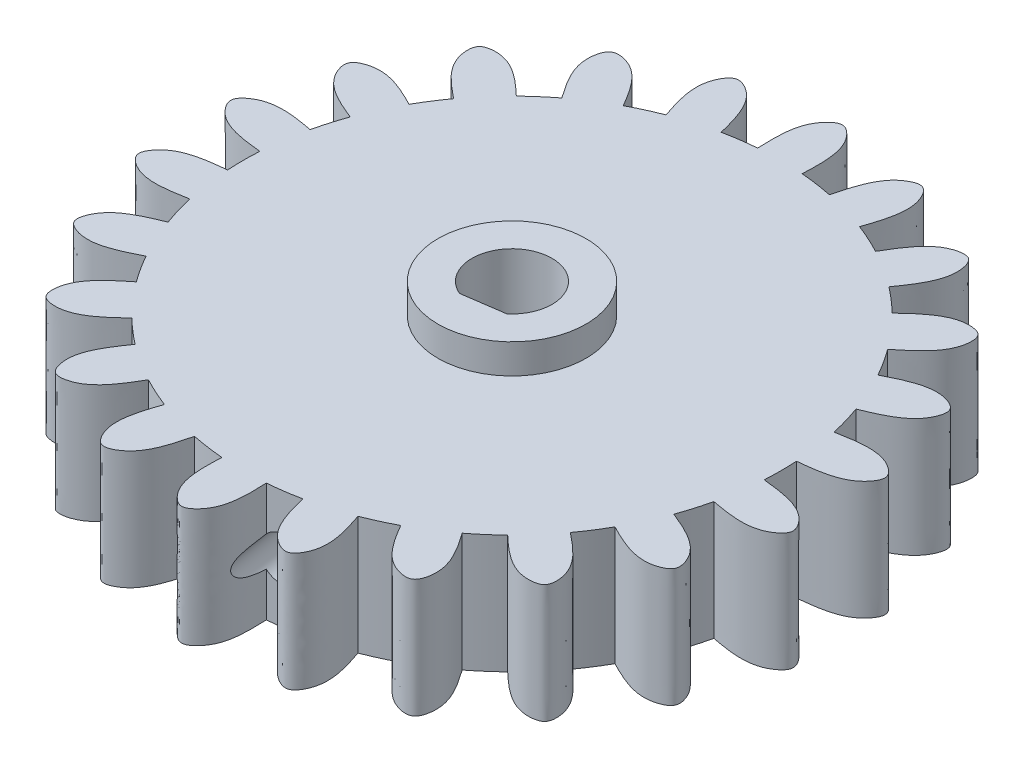
from build123d import *

# Parameters (mm, degrees)
SKETCH1_R           = 18.145
BOSS_EXTRUDE1_DEPTH = 10
SKETCH2_R           = 5
BOSS_EXTRUDE2_DEPTH = 2
BOSS_EXTRUDE5_DEPTH = 10
CIRPATTERN1_COUNT   = 22
CUT_EXTRUDE1_DEPTH  = 34.593002308
SKETCH6_R           = 36.478702283
CUT_EXTRUDE2_DEPTH  = 2
SKETCH9_R           = 1.5
CUT_EXTRUDE3_DEPTH  = 20


with BuildPart() as part:
    # Sketch1 → Boss-Extrude1 (new body)
    with BuildSketch(Plane(origin=(0, 0, 0), x_dir=(1, 0, 0), z_dir=(0, 1, 0))):
        Circle(SKETCH1_R)
    extrude(amount=BOSS_EXTRUDE1_DEPTH)

    # Sketch2 → Boss-Extrude2 (add)
    with BuildSketch(Plane(origin=(0, 10, 0), x_dir=(1, 0, 0), z_dir=(0, 1, 0))):
        Circle(SKETCH2_R)
    extrude(amount=BOSS_EXTRUDE2_DEPTH)

    # Sketch4 → Boss-Extrude5 (add)
    with BuildSketch(Plane.XZ):
        with BuildLine():
            Line((-1.5, -18.082893159), (1.5, -18.082893159))
            add(Edge.make_bspline(
                [(1.5, -18.082893159), (1.52233311, -18.648098407), (1.574363817, -19.964888924), (1.199302648, -21.578369116), (0, -22.486157989), (-1.199302648, -21.578369116), (-1.574363817, -19.964888924), (-1.52233311, -18.648098407), (-1.5, -18.082893159)],
                knots=[0, 0, 0, 0, 0.178316257, 0.415433434, 0.5, 0.584566566, 0.821683743, 1, 1, 1, 1], degree=3))
        make_face()
    boss_extrude5 = extrude(amount=-BOSS_EXTRUDE5_DEPTH)

    # CirPattern1: Boss-Extrude5 ×22 about axis
    cirpattern1_axis = Axis((0, 0, 0), (0, 1, 0))
    for i in range(1, CIRPATTERN1_COUNT):
        add(boss_extrude5.rotate(cirpattern1_axis, i * 360 / CIRPATTERN1_COUNT))

    # Sketch5 → Cut-Extrude1 (cut, through all)
    with BuildSketch(Plane(origin=(0, 12, 0), x_dir=(1, 0, 0), z_dir=(0, 1, 0))):
        with BuildLine():
            Line((1.727143035, -2.075325742), (-1.072494779, -2.477852891))
            ThreePointArc((-1.072494779, -2.477852891), (-0.384250063, 2.672517893), (1.727143035, -2.075325742))
        make_face()
    extrude(amount=-CUT_EXTRUDE1_DEPTH, mode=Mode.SUBTRACT)

    # Sketch6 → Cut-Extrude2 (cut)
    with BuildSketch(Plane.XZ):
        Circle(SKETCH6_R)
    extrude(amount=-CUT_EXTRUDE2_DEPTH, mode=Mode.SUBTRACT)

    # Sketch9 → Cut-Extrude3 (cut)
    with BuildSketch(Plane(origin=(0.327324128, 0, 2.276589316), x_dir=(-0.9898214418809327, 0, 0.14231483827328545), z_dir=(-0.14231483827328545, 0, -0.9898214418809328))):
        with Locations((0.000786438, 6)):
            Circle(SKETCH9_R)
    extrude(amount=-CUT_EXTRUDE3_DEPTH, mode=Mode.SUBTRACT)


solid = part.part
